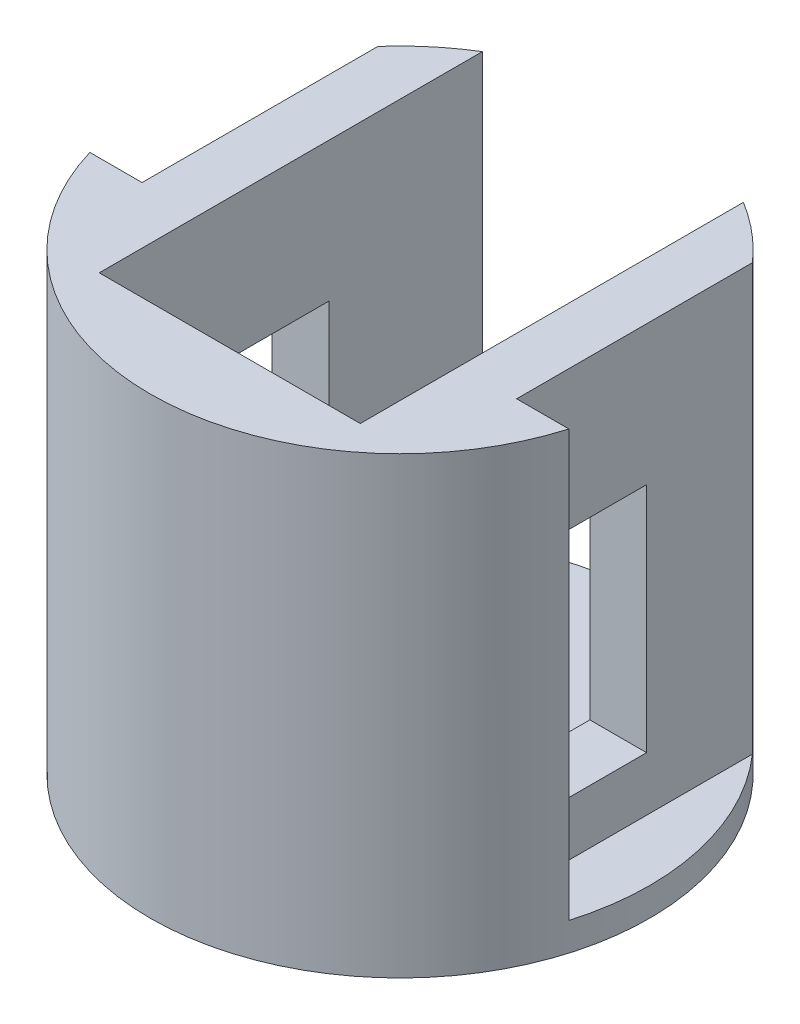
from build123d import *

# Parameters (mm, degrees)
SKETCH_1_R          = 44
EXTRUDE_1_DEPTH     = 80
CUT_EXTRUDE_START   = 5
SKETCH_2_W          = 23
SKETCH_2_H          = 74
CUT_EXTRUDE_5_DEPTH = 97.350875675
SKETCH_3_W          = 20.9
SKETCH_3_H          = 40.9
CUT_EXTRUDE_6_DEPTH = 120.436175424


with BuildPart() as part:
    # 草图1 → 凸台-拉伸1 (new body)
    with BuildSketch(Plane(origin=(0, 0, 0), x_dir=(1, 0, 0), z_dir=(0, 1, 0))):
        Circle(SKETCH_1_R)
    extrude(amount=EXTRUDE_1_DEPTH)

    # 草图2 → 切除-拉伸5 (cut, through all)
    with BuildSketch(Plane(origin=(0, 0, 0), x_dir=(1, 0, 0), z_dir=(0, 1, 0)).offset(CUT_EXTRUDE_START)):
        with BuildLine():
            Line((33, 29.103264422), (33, -12.45))
            Line((33, -12.45), (42.201866072, -12.45))
            ThreePointArc((42.201866072, -12.45), (42.959266884, 9.513221788), (33, 29.103264422))
        make_face()
        with Locations((11.5, 7)):
            Rectangle(SKETCH_2_W, SKETCH_2_H)
    cut_extrude_5 = extrude(amount=CUT_EXTRUDE_5_DEPTH, mode=Mode.SUBTRACT)

    # 镜向1: 切除-拉伸5 across plane
    add(cut_extrude_5.mirror(Plane(origin=(0, 0, 0), x_dir=(0, 0, 1), z_dir=(1, 0, 0))), mode=Mode.SUBTRACT)

    # 草图3 → 切除-拉伸6 (cut, through all)
    with BuildSketch(Plane(origin=(33, 0, 0), x_dir=(0, 0, -1), z_dir=(1, 0, 0))):
        with Locations((0, 35)):
            Rectangle(SKETCH_3_W, SKETCH_3_H)
    extrude(amount=-CUT_EXTRUDE_6_DEPTH, mode=Mode.SUBTRACT)


solid = part.part
